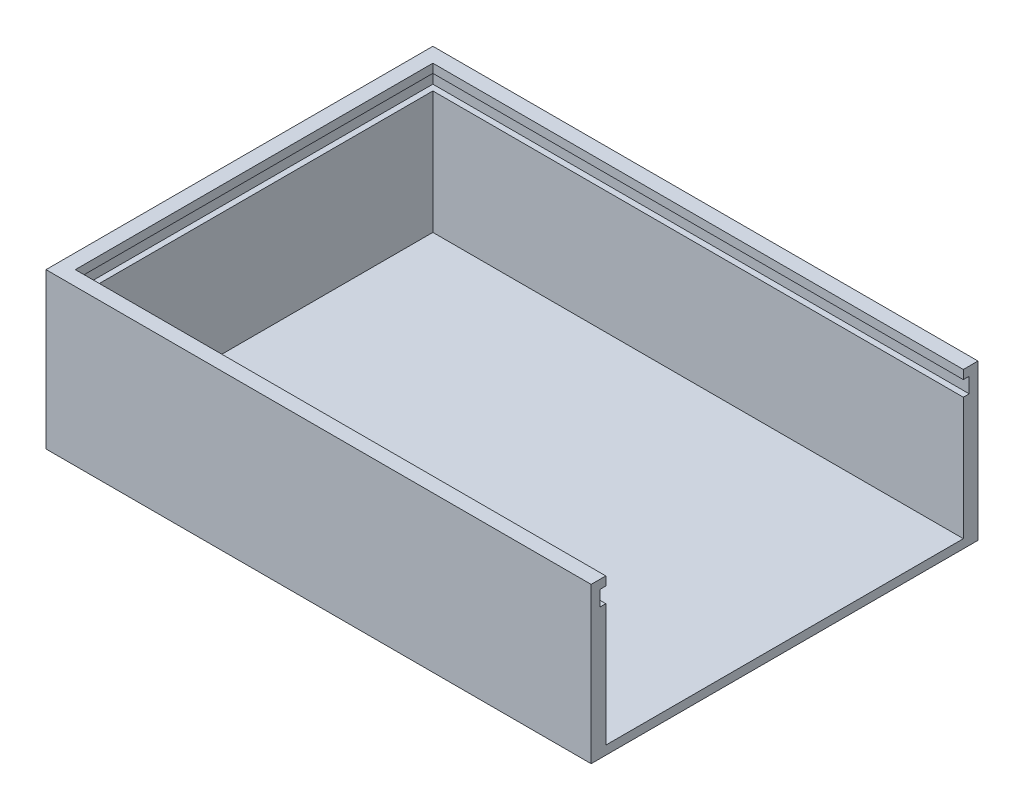
from build123d import *

# Parameters (mm, degrees)
ESQUISSE1_W             = 186
ESQUISSE1_H             = 132
BOSS_EXTRU_1_DEPTH      = 3
BOSS_EXTRU_4_DEPTH      = 50
ESQUISSE5_W             = 126
ESQUISSE5_H             = 5.2
ENL_V_MAT_EXTRU_1_DEPTH = 183


with BuildPart() as part:
    # Esquisse1 → Boss.-Extru.1 (new body)
    with BuildSketch(Plane(origin=(0, 0, 0), x_dir=(1, 0, 0), z_dir=(0, 1, 0))):
        Rectangle(ESQUISSE1_W, ESQUISSE1_H)
    extrude(amount=BOSS_EXTRU_1_DEPTH)

    # Esquisse4 → Boss.-Extru.4 (add)
    with BuildSketch(Plane(origin=(0, 3, 0), x_dir=(1, 0, 0), z_dir=(0, 1, 0))):
        Polygon((93, 61), (93, 66), (-93, 66), (-93, -66), (93, -66), (93, -61), (-88, -61), (-88, 61), align=None)
    extrude(amount=BOSS_EXTRU_4_DEPTH)

    # Esquisse5 → Enlèv. mat.-Extru.1 (cut)
    with BuildSketch(Plane(origin=(93, 0, 0), x_dir=(0, 0, -1), z_dir=(1, 0, 0))):
        with Locations((0, 47.4)):
            Rectangle(ESQUISSE5_W, ESQUISSE5_H)
    extrude(amount=-ENL_V_MAT_EXTRU_1_DEPTH, mode=Mode.SUBTRACT)


solid = part.part
